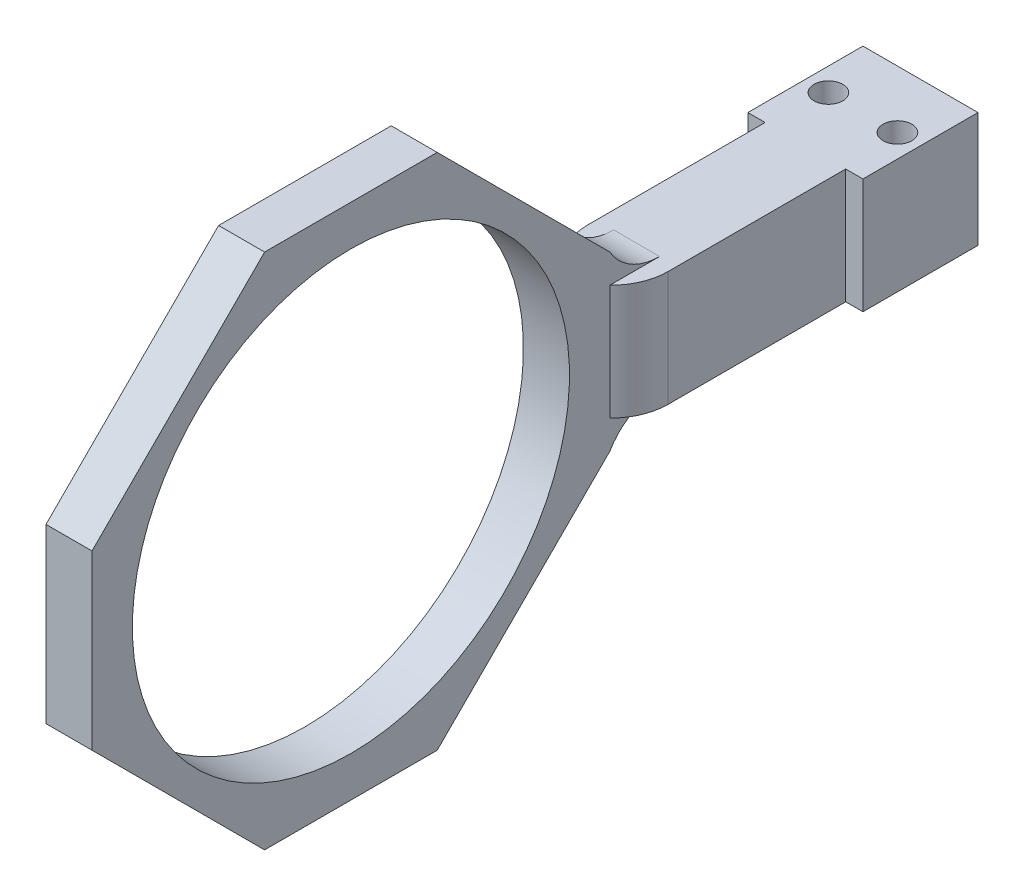
from build123d import *

# Parameters (mm, degrees)
SKETCH_1_W          = 20
SKETCH_1_H          = 20
EXTRUDE_1_DEPTH     = 20
SKETCH_2_W          = 14
SKETCH_2_H          = 20
EXTRUDE_2_DEPTH     = 38
SKETCH_8_W          = 8
SKETCH_8_H          = 90
EXTRUDE_4_DEPTH     = 90
CHAMFER_2_SIZE      = 30
CUT_EXTRUDE_3_DEPTH = 90
FILLET_1_R          = 10
SKETCH_10_R         = 2.5
CUT_EXTRUDE_4_DEPTH = 90


with BuildPart() as part:
    # 草图1 → 凸台-拉伸1 (new body)
    with BuildSketch(Plane.XY):
        Rectangle(SKETCH_1_W, SKETCH_1_H)
    extrude(amount=EXTRUDE_1_DEPTH)

    # 草图2 → 凸台-拉伸2 (add)
    with BuildSketch(Plane.XY.offset(20)):
        Rectangle(SKETCH_2_W, SKETCH_2_H)
    extrude(amount=EXTRUDE_2_DEPTH)

    # 草图8 → 凸台-拉伸4 (add)
    with BuildSketch(Plane.XY.offset(58)):
        Rectangle(SKETCH_8_W, SKETCH_8_H)
    extrude(amount=EXTRUDE_4_DEPTH)

    # 倒角2
    chamfer_2_edges = [part.edges().sort_by_distance(p)[0] for p in [
        (0, -45, 58),
        (0, 45, 58),
        (0, -45, 148),
        (0, 45, 148),
    ]]
    chamfer(chamfer_2_edges, length=CHAMFER_2_SIZE)

    # 草图9 → 切除-拉伸3 (cut)
    with BuildSketch(Plane(origin=(4, 0, 0), x_dir=(0, 0, -1), z_dir=(1, 0, 0))):
        with BuildLine():
            ThreePointArc((-65.010581468, 0), (-76.137424542, 26.862575458), (-103, 37.989418532))
            Line((-103, 37.989418532), (-103, -37.989418532))
            ThreePointArc((-103, -37.989418532), (-76.137424542, -26.862575458), (-65.010581468, 0))
        make_face()
        with BuildLine():
            Line((-103, -37.989418532), (-103, 37.989418532))
            ThreePointArc((-103, 37.989418532), (-140.989418532, 0), (-103, -37.989418532))
        make_face()
    extrude(amount=-CUT_EXTRUDE_3_DEPTH, mode=Mode.SUBTRACT)

    # 圆角1
    # the kernel refuses this fillet: 10 mm, written as the material it adds along each edge
    with BuildSketch(Plane(origin=(4, -10, 58), x_dir=(0, -1, 0), z_dir=(-1, 0, 0)), Plane(origin=(-4, 10, 58), x_dir=(0, 1, 0), z_dir=(1, 0, 0))) as fillet_1_piece_1:
        with BuildLine():
            CenterArc((10, -8.660254038), FILLET_1_R, 120, 60)
            Line((0, -8.660254038), (0, 0))
            Line((0, 0), (5, 0))
        make_face()
    extrude(amount=8)
    # the kernel refuses this fillet: 10 mm, written as the material it takes off along each edge
    with BuildSketch(Plane(origin=(7, 27.853571071, 58), x_dir=(-1, 0, 0), z_dir=(0, -1, 0)), Plane(origin=(-7, -27.853571071, 58), x_dir=(1, 0, 0), z_dir=(0, 1, 0))) as fillet_1_2_piece_1:
        with BuildLine():
            CenterArc((10, 7.141428429), FILLET_1_R, 180, 45.572995999)
            Line((0, 7.141428429), (0, 0))
            Line((0, 0), (3, 0))
        make_face()
    extrude(amount=55.707142143, mode=Mode.SUBTRACT)

    # 草图10 → 切除-拉伸4 (cut)
    with BuildSketch(Plane(origin=(0, 10, 0), x_dir=(1, 0, 0), z_dir=(0, 1, 0))):
        with Locations(Location((-6, -10, 0), (0, 0, 270))):
            Circle(SKETCH_10_R)
        with Locations(Location((6, -10, 0), (0, 0, 270))):
            Circle(SKETCH_10_R)
    extrude(amount=-CUT_EXTRUDE_4_DEPTH, mode=Mode.SUBTRACT)


solid = part.part
